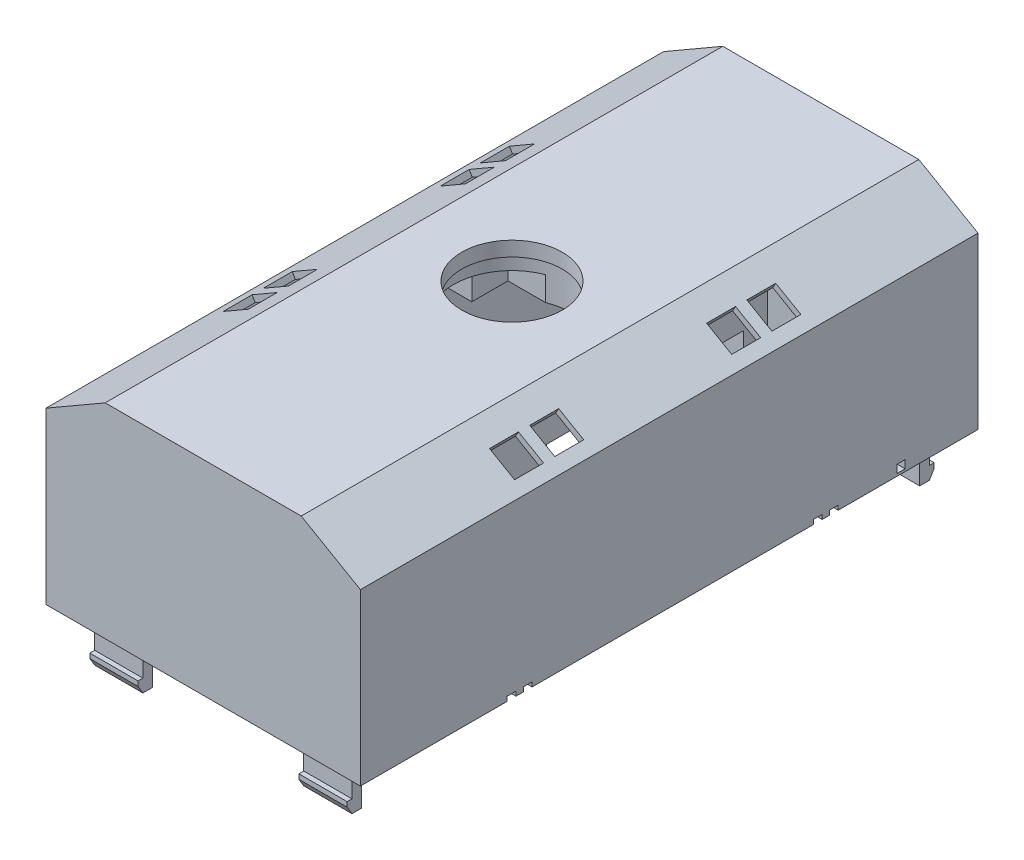
from build123d import *

# Parameters (mm, degrees)
BLOCK_START                       = 4.7
SKETCH1_W                         = 39.1
SKETCH1_H                         = 76.8
BLOCK_DEPTH                       = 25.40232
CELL_START                        = 4.7
SKETCH2_W                         = 36.9
SKETCH2_H                         = 53.5
CELL_POCKET_DEPTH                 = 14.3
LED_START                         = 4.7
SKETCH3_W                         = 5.3
SKETCH3_H                         = 2.3
LED_CLAMP_EAR_WAYS_DEPTH          = 14.3
CRADLE_START                      = 4.7
SKETCH4_W                         = 8.2
SKETCH4_H                         = 14.9
CRADLE_ARM_POCKET_DEPTH           = 1.6
J4_START                          = 4.7
SKETCH5_W                         = 17.5
SKETCH5_H                         = 4.8
J4_FLEX_RISER_DEPTH               = 20.69
FLEX_START                        = 19
SKETCH6_W                         = 17.5
SKETCH6_H                         = 20.9
FLEX_CHANNEL_OVER_THE_CELLS_DEPTH = 6.39
CAMERA_START                      = 19
SKETCH7_W                         = 25.6
SKETCH7_H                         = 24.5
CAMERA_BOARD_POCKET_DEPTH         = 4.08232
HOLDER_START                      = 22.98232
SKETCH8_W                         = 14.6
SKETCH8_H                         = 13.6
HOLDER_POCKET_DEPTH               = 3.1
SKETCH9_W                         = 22.6
SKETCH9_H                         = 4.6
HOLDER_EAR_POCKET_DEPTH           = 3.1
SKETCH10_W                        = 18.2
SKETCH10_H                        = 5.8
CAMERA_FFC_POCKET_DEPTH           = 6.39
BARREL_START                      = 19
SKETCH11_R                        = 7.3
BARREL_HOLE_DEPTH                 = 9.28232
LENS_START                        = 28.18232
SKETCH12_R                        = 6.25
LENS_THREAD_HOLE_DEPTH            = 26.189977771
CAMERA_START_2                    = 22.98232
SKETCH13_R                        = 0.8
CAMERA_SCREW_PILOTS_DEPTH         = 4.6
PROBE_START                       = 4.7
SKETCH14_W                        = 1.6
SKETCH14_H                        = 1.1
PROBE_WIRE_HALF_SLOTS_DEPTH       = 0.55
MIC_START                         = 5
SKETCH15_W                        = 1.4
SKETCH15_H                        = 1
MIC_DUCT_EXIT_DEPTH               = 1
CELL_START_2                      = 7.69
SKETCH16_W                        = 1.2
SKETCH16_H                        = 1.5
CELL_SIDE_RIBS_DEPTH              = 11.31
SKETCH17_W                        = 1.5
SKETCH17_H                        = 0.2
CELL_END_RIBS_FAR_END_DEPTH       = 11.31
SKETCH18_W                        = 1.5
SKETCH18_H                        = 0.2
CELL_END_RIBS_CAMERA_END_DEPTH    = 11.31
CELL_START_3                      = 18.8
SKETCH19_W                        = 2
SKETCH19_H                        = 2
CELL_TOP_PAD_DEPTH                = 0.2
CLIP_START                        = -16
CLIP_CAMERA_END_X_13_DEPTH        = 6
CLIP_START_2                      = 10
CLIP_CAMERA_END_X_13_2_DEPTH      = 6
CLIP_ANTENNA_END_X_13_DEPTH       = 6
CLIP_ANTENNA_END_X_13_2_DEPTH     = 6
CHAMFER_START                     = -40.5
CHAMFER_X_TOP_DEPTH               = 78.8
LED_START_2                       = -20.2
LED_STRIP_SHAFT_X_TOP_DEPTH       = 37.2
LED_STRIP_SEAT_X_TOP_DEPTH        = 37.2
CLAMP_START                       = -26.2
SKETCH27_W                        = 5.3
SKETCH27_H                        = 2.5
CLAMP_EAR_POCKET_X_TOP_26_DEPTH   = 6
CLAMP_START_2                     = 17
SKETCH28_W                        = 5.3
SKETCH28_H                        = 2.5
CLAMP_EAR_POCKET_X_TOP_17_DEPTH   = 6
CLAMP_START_3                     = 21.5
SKETCH29_R                        = 0.8
CLAMP_SCREW_PILOTS_X_TOP_DEPTH    = 5
LED_START_3                       = -18.9
LED_HOLE_X_TOP_3_DEPTH            = 3.6
LED_START_4                       = -13.9
LED_HOLE_X_TOP_8_DEPTH            = 3.6
LED_START_5                       = 8.1
LED_HOLE_X_TOP_30_DEPTH           = 3.6
LED_START_6                       = 13.1
LED_HOLE_X_TOP_35_DEPTH           = 3.6
CHAMFER_X_TOP_2_DEPTH             = 78.8
LED_STRIP_SHAFT_X_TOP_2_DEPTH     = 37.2
LED_STRIP_SEAT_X_TOP_2_DEPTH      = 37.2
SKETCH37_W                        = 5.3
SKETCH37_H                        = 2.5
CLAMP_EAR_POCKET_X_TOP_26_2_DEPTH = 6
SKETCH38_W                        = 5.3
SKETCH38_H                        = 2.5
CLAMP_EAR_POCKET_X_TOP_17_2_DEPTH = 6
SKETCH39_R                        = 0.8
CLAMP_SCREW_PILOTS_X_TOP_2_DEPTH  = 5
LED_HOLE_X_TOP_3_2_DEPTH          = 3.6
LED_HOLE_X_TOP_8_2_DEPTH          = 3.6
LED_HOLE_X_TOP_30_2_DEPTH         = 3.6
LED_HOLE_X_TOP_35_2_DEPTH         = 3.6


with BuildPart() as part:
    # Sketch1 → Block (new body)
    with BuildSketch(Plane(origin=(0, 0, 0), x_dir=(1, 0, 0), z_dir=(0, 1, 0)).offset(BLOCK_START)):
        with Locations((0, 1.1)):
            Rectangle(SKETCH1_W, SKETCH1_H)
    extrude(amount=BLOCK_DEPTH)

    # Sketch2 → Cell pocket (cut)
    with BuildSketch(Plane(origin=(0, 0, 0), x_dir=(1, 0, 0), z_dir=(0, 1, 0)).offset(CELL_START)):
        with Locations((0, 5.95)):
            Rectangle(SKETCH2_W, SKETCH2_H)
    extrude(amount=CELL_POCKET_DEPTH, mode=Mode.SUBTRACT)

    # Sketch3 → LED clamp ear ways (cut)
    with BuildSketch(Plane(origin=(0, 0, 0), x_dir=(1, 0, 0), z_dir=(0, 1, 0)).offset(LED_START)):
        with Locations((15.35, -21.85)):
            Rectangle(SKETCH3_W, SKETCH3_H)
        with Locations((-15.35, -21.85)):
            Rectangle(SKETCH3_W, SKETCH3_H)
    extrude(amount=LED_CLAMP_EAR_WAYS_DEPTH, mode=Mode.SUBTRACT)

    # Sketch4 → Cradle arm pocket (cut)
    with BuildSketch(Plane(origin=(0, 0, 0), x_dir=(1, 0, 0), z_dir=(0, 1, 0)).offset(CRADLE_START)):
        with Locations((0, -28.15)):
            Rectangle(SKETCH4_W, SKETCH4_H)
    extrude(amount=CRADLE_ARM_POCKET_DEPTH, mode=Mode.SUBTRACT)

    # Sketch5 → J4 flex riser (cut)
    with BuildSketch(Plane(origin=(0, 0, 0), x_dir=(1, 0, 0), z_dir=(0, 1, 0)).offset(J4_START)):
        with Locations((-0.35, 35.1)):
            Rectangle(SKETCH5_W, SKETCH5_H)
    extrude(amount=J4_FLEX_RISER_DEPTH, mode=Mode.SUBTRACT)

    # Sketch6 → Flex channel over the cells (cut)
    with BuildSketch(Plane(origin=(0, 0, 0), x_dir=(1, 0, 0), z_dir=(0, 1, 0)).offset(FLEX_START)):
        with Locations((-0.35, 27.05)):
            Rectangle(SKETCH6_W, SKETCH6_H)
    extrude(amount=FLEX_CHANNEL_OVER_THE_CELLS_DEPTH, mode=Mode.SUBTRACT)

    # Sketch7 → Camera board pocket (cut)
    with BuildSketch(Plane(origin=(0, 0, 0), x_dir=(1, 0, 0), z_dir=(0, 1, 0)).offset(CAMERA_START)):
        with Locations((0, 4.95)):
            Rectangle(SKETCH7_W, SKETCH7_H)
    extrude(amount=CAMERA_BOARD_POCKET_DEPTH, mode=Mode.SUBTRACT)

    # Sketch8 → Holder pocket (cut)
    with BuildSketch(Plane(origin=(0, 0, 0), x_dir=(1, 0, 0), z_dir=(0, 1, 0)).offset(HOLDER_START)):
        with Locations((0, 1.1)):
            Rectangle(SKETCH8_W, SKETCH8_H)
    extrude(amount=HOLDER_POCKET_DEPTH, mode=Mode.SUBTRACT)

    # Sketch9 → Holder ear pocket (cut)
    with BuildSketch(Plane(origin=(0, 0, 0), x_dir=(1, 0, 0), z_dir=(0, 1, 0)).offset(HOLDER_START)):
        with Locations((0, 1.1)):
            Rectangle(SKETCH9_W, SKETCH9_H)
    extrude(amount=HOLDER_EAR_POCKET_DEPTH, mode=Mode.SUBTRACT)

    # Sketch10 → Camera FFC pocket (cut)
    with BuildSketch(Plane(origin=(0, 0, 0), x_dir=(1, 0, 0), z_dir=(0, 1, 0)).offset(CAMERA_START)):
        with Locations((0, 15)):
            Rectangle(SKETCH10_W, SKETCH10_H)
    extrude(amount=CAMERA_FFC_POCKET_DEPTH, mode=Mode.SUBTRACT)

    # Sketch11 → Barrel hole (cut)
    with BuildSketch(Plane(origin=(0, 0, 0), x_dir=(1, 0, 0), z_dir=(0, 1, 0)).offset(BARREL_START)):
        with Locations((0, 1.1)):
            Circle(SKETCH11_R)
    extrude(amount=BARREL_HOLE_DEPTH, mode=Mode.SUBTRACT)

    # Sketch12 → Lens thread hole (cut, through all)
    with BuildSketch(Plane(origin=(0, 0, 0), x_dir=(1, 0, 0), z_dir=(0, 1, 0)).offset(LENS_START)):
        with Locations((0, 1.1)):
            Circle(SKETCH12_R)
    extrude(amount=LENS_THREAD_HOLE_DEPTH, mode=Mode.SUBTRACT)

    # Sketch13 → Camera screw pilots (cut)
    with BuildSketch(Plane(origin=(0, 0, 0), x_dir=(1, 0, 0), z_dir=(0, 1, 0)).offset(CAMERA_START_2)):
        with Locations((10.5, 7.52)):
            Circle(SKETCH13_R)
        with Locations((-10.5, 7.52)):
            Circle(SKETCH13_R)
        with Locations((10.5, -4.98)):
            Circle(SKETCH13_R)
        with Locations((-10.5, -4.98)):
            Circle(SKETCH13_R)
    extrude(amount=CAMERA_SCREW_PILOTS_DEPTH, mode=Mode.SUBTRACT)

    # Sketch14 → Probe wire half-slots (cut)
    with BuildSketch(Plane(origin=(0, 0, 0), x_dir=(1, 0, 0), z_dir=(0, 1, 0)).offset(PROBE_START)):
        with Locations((-18.95, 2.5)):
            Rectangle(SKETCH14_W, SKETCH14_H)
        with Locations((-18.95, 0.5)):
            Rectangle(SKETCH14_W, SKETCH14_H)
        with Locations((18.95, 21.57)):
            Rectangle(SKETCH14_W, SKETCH14_H)
        with Locations((18.95, 19.57)):
            Rectangle(SKETCH14_W, SKETCH14_H)
        with Locations((18.95, -16.5)):
            Rectangle(SKETCH14_W, SKETCH14_H)
        with Locations((18.95, -18.5)):
            Rectangle(SKETCH14_W, SKETCH14_H)
    extrude(amount=PROBE_WIRE_HALF_SLOTS_DEPTH, mode=Mode.SUBTRACT)

    # Sketch15 → Mic duct exit (cut)
    with BuildSketch(Plane(origin=(0, 0, 0), x_dir=(1, 0, 0), z_dir=(0, 1, 0)).offset(MIC_START)):
        with Locations((19.05, 29.94)):
            Rectangle(SKETCH15_W, SKETCH15_H)
    extrude(amount=MIC_DUCT_EXIT_DEPTH, mode=Mode.SUBTRACT)

    # Sketch16 → Cell side ribs (add)
    with BuildSketch(Plane(origin=(0, 0, 0), x_dir=(1, 0, 0), z_dir=(0, 1, 0)).offset(CELL_START_2)):
        with Locations((-17.85, 28)):
            Rectangle(SKETCH16_W, SKETCH16_H)
        with Locations((17.85, 28)):
            Rectangle(SKETCH16_W, SKETCH16_H)
    extrude(amount=CELL_SIDE_RIBS_DEPTH)

    # Sketch17 → Cell end ribs, far end (add)
    with BuildSketch(Plane(origin=(0, 0, 0), x_dir=(1, 0, 0), z_dir=(0, 1, 0)).offset(CELL_START_2)):
        with Locations((-10, -20.7)):
            Rectangle(SKETCH17_W, SKETCH17_H)
        with Locations((0, -20.7)):
            Rectangle(SKETCH17_W, SKETCH17_H)
        with Locations((10, -20.7)):
            Rectangle(SKETCH17_W, SKETCH17_H)
    extrude(amount=CELL_END_RIBS_FAR_END_DEPTH)

    # Sketch18 → Cell end ribs, camera end (add)
    with BuildSketch(Plane(origin=(0, 0, 0), x_dir=(1, 0, 0), z_dir=(0, 1, 0)).offset(CELL_START_2)):
        with Locations((-14, 32.6)):
            Rectangle(SKETCH18_W, SKETCH18_H)
        with Locations((13, 32.6)):
            Rectangle(SKETCH18_W, SKETCH18_H)
    extrude(amount=CELL_END_RIBS_CAMERA_END_DEPTH)

    # Sketch19 → Cell top pad (add)
    with BuildSketch(Plane(origin=(0, 0, 0), x_dir=(1, 0, 0), z_dir=(0, 1, 0)).offset(CELL_START_3)):
        with Locations((0, -15)):
            Rectangle(SKETCH19_W, SKETCH19_H)
    extrude(amount=CELL_TOP_PAD_DEPTH)

    # Sketch20 → Clip camera end X -13 (add)
    with BuildSketch(Plane(origin=(0, 0, 0), x_dir=(0, 0, -1), z_dir=(1, 0, 0)).offset(CLIP_START)):
        Polygon((35.8, 5), (37, 5), (37, 0.3), (37.6, 0.3), (37.6, -0.3), (37, -1.3), (35.8, -1.3), align=None)
    extrude(amount=CLIP_CAMERA_END_X_13_DEPTH)

    # Sketch21 → Clip camera end X _13 2 (add)
    with BuildSketch(Plane(origin=(0, 0, 0), x_dir=(0, 0, -1), z_dir=(1, 0, 0)).offset(CLIP_START_2)):
        Polygon((35.8, 5), (37, 5), (37, 0.3), (37.6, 0.3), (37.6, -0.3), (37, -1.3), (35.8, -1.3), align=None)
    extrude(amount=CLIP_CAMERA_END_X_13_2_DEPTH)

    # Sketch22 → Clip antenna end X -13 (add)
    with BuildSketch(Plane(origin=(0, 0, 0), x_dir=(0, 0, -1), z_dir=(1, 0, 0)).offset(CLIP_START)):
        Polygon((-33.6, 5), (-34.8, 5), (-34.8, 0.3), (-35.4, 0.3), (-35.4, -0.3), (-34.8, -1.3), (-33.6, -1.3), align=None)
    extrude(amount=CLIP_ANTENNA_END_X_13_DEPTH)

    # Sketch23 → Clip antenna end X _13 2 (add)
    with BuildSketch(Plane(origin=(0, 0, 0), x_dir=(0, 0, -1), z_dir=(1, 0, 0)).offset(CLIP_START_2)):
        Polygon((-33.6, 5), (-34.8, 5), (-34.8, 0.3), (-35.4, 0.3), (-35.4, -0.3), (-34.8, -1.3), (-33.6, -1.3), align=None)
    extrude(amount=CLIP_ANTENNA_END_X_13_2_DEPTH)

    # Sketch24 → Chamfer -X top (cut)
    with BuildSketch(Plane.XY.offset(CHAMFER_START)):
        Polygon((-11.322758664, 30.60232), (-20.55, 31.10232), (-20.416025404, 25.35232), align=None)
    extrude(amount=CHAMFER_X_TOP_DEPTH, mode=Mode.SUBTRACT)

    # Sketch25 → LED strip shaft -X top (cut)
    with BuildSketch(Plane.XY.offset(LED_START_2)):
        Polygon((-18.003878, 19), (-12.700546001, 19), (-12.700546001, 26.088718003), (-13.500546001, 27.474359003), (-14.555065001, 27.800839003), (-17.759359, 25.950839), (-18.003878, 24.874359), align=None)
    extrude(amount=LED_STRIP_SHAFT_X_TOP_DEPTH, mode=Mode.SUBTRACT)

    # Sketch26 → LED strip seat -X top (cut)
    with BuildSketch(Plane.XY.offset(LED_START_2)):
        Polygon((-18.433878, 25.619141), (-17.633878, 24.2335), (-17.203878, 23.488718), (-12.700545975, 26.088717957), (-13.500545975, 27.474358957), (-13.930545975, 28.219140957), align=None)
    extrude(amount=LED_STRIP_SEAT_X_TOP_DEPTH, mode=Mode.SUBTRACT)

    # Sketch27 → Clamp ear pocket -X top -26 (cut)
    with BuildSketch(Plane.XY.offset(CLAMP_START)):
        with Locations((-15.35, 20.25)):
            Rectangle(SKETCH27_W, SKETCH27_H)
    extrude(amount=CLAMP_EAR_POCKET_X_TOP_26_DEPTH, mode=Mode.SUBTRACT)

    # Sketch28 → Clamp ear pocket -X top 17 (cut)
    with BuildSketch(Plane.XY.offset(CLAMP_START_2)):
        with Locations((-15.35, 20.25)):
            Rectangle(SKETCH28_W, SKETCH28_H)
    extrude(amount=CLAMP_EAR_POCKET_X_TOP_17_DEPTH, mode=Mode.SUBTRACT)

    # Sketch29 → Clamp screw pilots -X top (cut)
    with BuildSketch(Plane(origin=(0, 0, 0), x_dir=(1, 0, 0), z_dir=(0, 1, 0)).offset(CLAMP_START_3)):
        with Locations((-15.35, 23.2)):
            Circle(SKETCH29_R)
        with Locations((-15.35, -20)):
            Circle(SKETCH29_R)
    extrude(amount=CLAMP_SCREW_PILOTS_X_TOP_DEPTH, mode=Mode.SUBTRACT)

    # Sketch30 → LED hole -X top 3 (cut)
    with BuildSketch(Plane.XY.offset(LED_START_3)):
        Polygon((-15.15336663, 28.737127621), (-18.271058084, 26.937127621), (-17.716058084, 25.975839423), (-14.59836663, 27.775839423), align=None)
    extrude(amount=LED_HOLE_X_TOP_3_DEPTH, mode=Mode.SUBTRACT)

    # Sketch31 → LED hole -X top 8 (cut)
    with BuildSketch(Plane.XY.offset(LED_START_4)):
        Polygon((-15.15336663, 28.737127621), (-18.271058084, 26.937127621), (-17.716058084, 25.975839423), (-14.59836663, 27.775839423), align=None)
    extrude(amount=LED_HOLE_X_TOP_8_DEPTH, mode=Mode.SUBTRACT)

    # Sketch32 → LED hole -X top 30 (cut)
    with BuildSketch(Plane.XY.offset(LED_START_5)):
        Polygon((-15.15336663, 28.737127621), (-18.271058084, 26.937127621), (-17.716058084, 25.975839423), (-14.59836663, 27.775839423), align=None)
    extrude(amount=LED_HOLE_X_TOP_30_DEPTH, mode=Mode.SUBTRACT)

    # Sketch33 → LED hole -X top 35 (cut)
    with BuildSketch(Plane.XY.offset(LED_START_6)):
        Polygon((-15.15336663, 28.737127621), (-18.271058084, 26.937127621), (-17.716058084, 25.975839423), (-14.59836663, 27.775839423), align=None)
    extrude(amount=LED_HOLE_X_TOP_35_DEPTH, mode=Mode.SUBTRACT)

    # Sketch34 → Chamfer _X top 2 (cut)
    with BuildSketch(Plane.XY.offset(CHAMFER_START)):
        Polygon((11.322758664, 30.60232), (20.55, 31.10232), (20.416025404, 25.35232), align=None)
    extrude(amount=CHAMFER_X_TOP_2_DEPTH, mode=Mode.SUBTRACT)

    # Sketch35 → LED strip shaft _X top 2 (cut)
    with BuildSketch(Plane.XY.offset(LED_START_2)):
        Polygon((12.700546, 19), (18.003877999, 19), (18.003877999, 24.874358997), (17.759358999, 25.950838997), (14.555065, 27.800839), (13.500546, 27.474359), (12.700546, 26.088718), align=None)
    extrude(amount=LED_STRIP_SHAFT_X_TOP_2_DEPTH, mode=Mode.SUBTRACT)

    # Sketch36 → LED strip seat _X top 2 (cut)
    with BuildSketch(Plane.XY.offset(LED_START_2)):
        Polygon((12.700546, 26.088718), (17.203878025, 23.488718043), (17.633878025, 24.233500043), (18.433878025, 25.619141043), (13.930546, 28.219141), (13.500546, 27.474359), align=None)
    extrude(amount=LED_STRIP_SEAT_X_TOP_2_DEPTH, mode=Mode.SUBTRACT)

    # Sketch37 → Clamp ear pocket _X top -26 2 (cut)
    with BuildSketch(Plane.XY.offset(CLAMP_START)):
        with Locations((15.35, 20.25)):
            Rectangle(SKETCH37_W, SKETCH37_H)
    extrude(amount=CLAMP_EAR_POCKET_X_TOP_26_2_DEPTH, mode=Mode.SUBTRACT)

    # Sketch38 → Clamp ear pocket _X top 17 2 (cut)
    with BuildSketch(Plane.XY.offset(CLAMP_START_2)):
        with Locations((15.35, 20.25)):
            Rectangle(SKETCH38_W, SKETCH38_H)
    extrude(amount=CLAMP_EAR_POCKET_X_TOP_17_2_DEPTH, mode=Mode.SUBTRACT)

    # Sketch39 → Clamp screw pilots _X top 2 (cut)
    with BuildSketch(Plane(origin=(0, 0, 0), x_dir=(1, 0, 0), z_dir=(0, 1, 0)).offset(CLAMP_START_3)):
        with Locations((15.35, 23.2)):
            Circle(SKETCH39_R)
        with Locations((15.35, -20)):
            Circle(SKETCH39_R)
    extrude(amount=CLAMP_SCREW_PILOTS_X_TOP_2_DEPTH, mode=Mode.SUBTRACT)

    # Sketch40 → LED hole _X top 3 2 (cut)
    with BuildSketch(Plane.XY.offset(LED_START_3)):
        Polygon((15.15336663, 28.737127621), (18.271058084, 26.937127621), (17.716058084, 25.975839423), (14.59836663, 27.775839423), align=None)
    extrude(amount=LED_HOLE_X_TOP_3_2_DEPTH, mode=Mode.SUBTRACT)

    # Sketch41 → LED hole _X top 8 2 (cut)
    with BuildSketch(Plane.XY.offset(LED_START_4)):
        Polygon((15.15336663, 28.737127621), (18.271058084, 26.937127621), (17.716058084, 25.975839423), (14.59836663, 27.775839423), align=None)
    extrude(amount=LED_HOLE_X_TOP_8_2_DEPTH, mode=Mode.SUBTRACT)

    # Sketch42 → LED hole _X top 30 2 (cut)
    with BuildSketch(Plane.XY.offset(LED_START_5)):
        Polygon((15.15336663, 28.737127621), (18.271058084, 26.937127621), (17.716058084, 25.975839423), (14.59836663, 27.775839423), align=None)
    extrude(amount=LED_HOLE_X_TOP_30_2_DEPTH, mode=Mode.SUBTRACT)

    # Sketch43 → LED hole _X top 35 2 (cut)
    with BuildSketch(Plane.XY.offset(LED_START_6)):
        Polygon((15.15336663, 28.737127621), (18.271058084, 26.937127621), (17.716058084, 25.975839423), (14.59836663, 27.775839423), align=None)
    extrude(amount=LED_HOLE_X_TOP_35_2_DEPTH, mode=Mode.SUBTRACT)


solid = part.part
